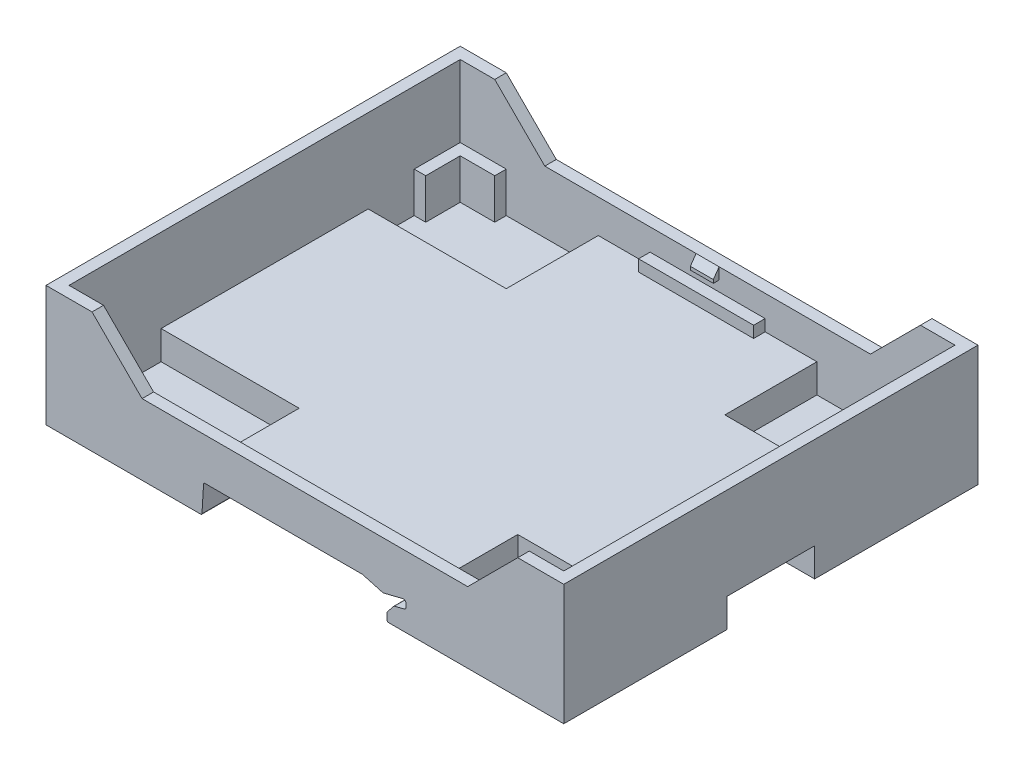
from build123d import *

# Parameters (mm, degrees)
SKETCH_1_W                  = 90
SKETCH_1_H                  = 72
EXTRUDE_1_DEPTH             = 21
CUT_EXTRUDE_1_DEPTH         = 72
FILLET_1_R                  = 0.5
FILLET_2_R                  = 0.2
CUT_EXTRUDE_2_DEPTH         = 28
SKETCH_6_W                  = 5
SKETCH_6_H                  = 2
CUT_EXTRUDE_3_DEPTH         = 2.4
FILLET_3_R                  = 0.5
EXTRUDE_2_DEPTH             = 3.5
FILLET_4_R                  = 1
FILLET_5_R                  = 0.3
CHAMFER_1_SIZE              = 1
SKETCH_8_W                  = 2.9
SKETCH_8_H                  = 4
EXTRUDE_3_DEPTH             = 2.5
CHAMFER_2_SIZE              = 2
CHAMFER_2_SIZE2             = 1.400415076
FILLET_6_R                  = 0.2
FILLET_7_R                  = 0.3
FILLET_8_R                  = 0.2
SKETCH_9_W                  = 15.2
SKETCH_9_H                  = 5
CUT_EXTRUDE_4_DEPTH         = 36
SKETCH_10_W                 = 7.6
SKETCH_10_H                 = 5
CUT_EXTRUDE_5_DEPTH         = 4
CUT_EXTRUDE_6_DEPTH         = 72
SKETCH_12_W                 = 86
SKETCH_12_H                 = 68
CUT_EXTRUDE_7_DEPTH         = 14.5
SKETCH_13_W                 = 24
SKETCH_13_H                 = 16
CUT_EXTRUDE_8_DEPTH         = 5
MIRROR_4_COPY_1_SKETCH_W    = 24
MIRROR_4_COPY_1_SKETCH_H    = 16
MIRROR_4_COPY_1_DEPTH       = 5
EXTRUDE_4_DEPTH             = 7
MIRROR_6_COPY_1_DEPTH       = 7
SKETCH_15_W                 = 20
SKETCH_15_H                 = 2
EXTRUDE_5_DEPTH             = 2
SKETCH_17_W                 = 4
SKETCH_17_H                 = 2
EXTRUDE_6_DEPTH             = 1
CHAMFER_3_SIZE              = 1
CHAMFER_3_SIZE2             = 1.428148007
CHAMFER_3_OF_MIRROR_8_SIZE2 = 1.428148007
CHAMFER_3_OF_MIRROR_8_SIZE  = 1


with BuildPart() as part:
    # 草图1 → 凸台-拉伸1 (new body)
    with BuildSketch(Plane(origin=(0, 0, 0), x_dir=(1, 0, 0), z_dir=(0, 1, 0))):
        Rectangle(SKETCH_1_W, SKETCH_1_H)
    extrude(amount=EXTRUDE_1_DEPTH)

    # 草图4 → 切除-拉伸1 (cut)
    with BuildSketch(Plane.XY.offset(36)):
        Polygon((14.3, 0), (14.3, 1.5), (15.489963906, 2.965295015), (17.6, 3.5), (17.6, 5), (13.598917425, 4.003578801), (10, 5), (-17.6, 5), (-17.9, 0), align=None)
    extrude(amount=-CUT_EXTRUDE_1_DEPTH, mode=Mode.SUBTRACT)

    # 圆角1
    fillet_1_edges = [part.edges().sort_by_distance(p)[0] for p in [
        (17.6, 5, 0),
        (17.6, 3.5, 0),
    ]]
    fillet(fillet_1_edges, radius=FILLET_1_R)

    # 圆角2
    fillet_2_edges = [part.edges().sort_by_distance(p)[0] for p in [
        (14.3, 0, 0),
        (-17.9, 0, 0),
        (-17.6, 5, 0),
        (15.489963906, 2.965295015, 0),
        (14.3, 1.5, 0),
    ]]
    fillet(fillet_2_edges, radius=FILLET_2_R)

    # 草图5 → 切除-拉伸2 (cut)
    with BuildSketch(Plane.ZY.offset(45)):
        Polygon((5.6, 0), (5.6, 2.4), (7.6, 2.4), (7.6, 5), (-7.6, 5), (-7.6, 2.4), (-5.6, 2.4), (-5.6, 0), align=None)
    extrude(amount=-CUT_EXTRUDE_2_DEPTH, mode=Mode.SUBTRACT)

    # 草图6 → 切除-拉伸3 (cut)
    with BuildSketch(Plane.XZ):
        with Locations((-30.5, 6.6)):
            Rectangle(SKETCH_6_W, SKETCH_6_H)
    cut_extrude_3 = extrude(amount=-CUT_EXTRUDE_3_DEPTH, mode=Mode.SUBTRACT)

    # 镜向1: 切除-拉伸3 across plane
    add(cut_extrude_3.mirror(Plane(origin=(0, 0, 0), x_dir=(1, 0, 0), z_dir=(0, 0, -1))), mode=Mode.SUBTRACT)

    # 圆角3
    fillet_3_edges = [part.edges().sort_by_distance(p)[0] for p in [
        (-31.205820162, 5, -7.6),
        (-31.205820162, 5, 7.6),
    ]]
    fillet(fillet_3_edges, radius=FILLET_3_R)

    # 草图7 → 凸台-拉伸2 (add)
    with BuildSketch(Plane.XZ.offset(-5)):
        Polygon((-33, 3.2), (-33, -3.2), (-28, -3.2), (-32, -1), (-32, 1), (-28, 3.2), align=None)
    extrude(amount=EXTRUDE_2_DEPTH)

    # 圆角4
    fillet_4_edges = [part.edges().sort_by_distance(p)[0] for p in [
        (-32, 3.25, -1),
        (-32, 3.25, 1),
    ]]
    fillet(fillet_4_edges, radius=FILLET_4_R)

    # 圆角5
    fillet_5_edges = [part.edges().sort_by_distance(p)[0] for p in [
        (-28, 3.25, 3.2),
        (-28, 3.25, -3.2),
    ]]
    fillet(fillet_5_edges, radius=FILLET_5_R)

    # 倒角1
    chamfer_1_edges = [part.edges().sort_by_distance(p)[0] for p in [
        (-33, 3.25, 3.2),
        (-33, 3.25, -3.2),
    ]]
    chamfer(chamfer_1_edges, length=CHAMFER_1_SIZE)

    # 草图8 → 凸台-拉伸3 (add)
    with BuildSketch(Plane.XZ.offset(-5)):
        with Locations((-35.91, 0)):
            Rectangle(SKETCH_8_W, SKETCH_8_H)
    extrude(amount=EXTRUDE_3_DEPTH)

    # 倒角2
    chamfer_2_edges = [part.edges().sort_by_distance(p)[0] for p in [
        (-34.46, 2.5, 0),
    ]]
    chamfer_2_side = [part.faces().sort_by_distance(p)[0] for p in [
        (-35.91, 2.5, 0),
    ]]
    chamfer(chamfer_2_edges, length=CHAMFER_2_SIZE, length2=CHAMFER_2_SIZE2, reference=chamfer_2_side[0])

    # 圆角6
    fillet_6_edges = [part.edges().sort_by_distance(p)[0] for p in [
        (-37.36, 5, 0),
        (-37.36, 3.75, 2),
        (-35.91, 5, -2),
        (-37.36, 3.75, -2),
        (-34.46, 5, 0),
        (-35.91, 5, 2),
        (-37.36, 2.5, 0),
        (-36.91, 2.5, -2),
        (-34.46, 4.450207538, -2),
        (-35.46, 3.200207538, -2),
    ]]
    fillet(fillet_6_edges, radius=FILLET_6_R)

    # 圆角7
    # the kernel refuses this fillet: 0.3 mm, written as the material it takes off along each edge
    with BuildSketch(Plane(origin=(-36.554589637, 2.8, -2), x_dir=(0.5735764363510475, -0.8191520442889909, 0), z_dir=(0.8191520442889909, 0.5735764363510475, 0))) as fillet_7_piece_1:
        with BuildLine():
            CenterArc((0.1, -0.2), 0.2, 0, 90)
            Line((0.3, -0.2), (0.3, 0))
            Line((0.3, 0), (0.1, 0))
        make_face()
    revolve(axis=Axis((-36.554589637, 2.8, -2), (0, 0, -1)), revolution_arc=35, mode=Mode.SUBTRACT)
    with BuildSketch(Plane(origin=(-36.46, 2.5, 2.236474092), x_dir=(0.8191520442890007, 0.5735764363510335, 0), z_dir=(0, 0, -1))) as fillet_7_piece_2:
        with BuildLine():
            CenterArc((FILLET_7_R * 0.315298788879, -FILLET_7_R), FILLET_7_R, 90, 35)
            Line((-FILLET_7_R * 0.258277647472, -FILLET_7_R * 0.180847955711), (0, 0))
            Line((0, 0), (FILLET_7_R * 0.315298788879, 0))
        make_face()
    extrude(amount=4.236474092, mode=Mode.SUBTRACT)

    # 圆角8
    fillet_8_edges = [part.edges().sort_by_distance(p)[0] for p in [
        (-34.46, 3.900415076, 0.1),
        (-34.522857251, 3.93313649, -1.945574265),
    ]]
    fillet(fillet_8_edges, radius=FILLET_8_R)

    # 草图9 → 切除-拉伸4 (cut)
    with BuildSketch(Plane(origin=(45, 0, 0), x_dir=(0, 0, -1), z_dir=(1, 0, 0))):
        with Locations((0, 2.5)):
            Rectangle(SKETCH_9_W, SKETCH_9_H)
    extrude(amount=-CUT_EXTRUDE_4_DEPTH, mode=Mode.SUBTRACT)

    # 草图10 → 切除-拉伸5 (cut)
    with BuildSketch(Plane(origin=(0, 0, 7.6), x_dir=(-1, 0, 0), z_dir=(0, 0, -1))):
        with Locations((-13.8, 2.5)):
            Rectangle(SKETCH_10_W, SKETCH_10_H)
    cut_extrude_5 = extrude(amount=-CUT_EXTRUDE_5_DEPTH, mode=Mode.SUBTRACT)

    # 镜向2: 切除-拉伸5 across plane
    add(cut_extrude_5.mirror(Plane(origin=(0, 0, 0), x_dir=(1, 0, 0), z_dir=(0, 0, -1))), mode=Mode.SUBTRACT)

    # 草图11 → 切除-拉伸6 (cut)
    with BuildSketch(Plane.XY.offset(36)):
        Polygon((-37, 21), (37, 21), (28.3, 12.3), (-28.3, 12.3), align=None)
    extrude(amount=-CUT_EXTRUDE_6_DEPTH, mode=Mode.SUBTRACT)

    # 草图12 → 切除-拉伸7 (cut)
    with BuildSketch(Plane(origin=(0, 21, 0), x_dir=(1, 0, 0), z_dir=(0, 1, 0))):
        Rectangle(SKETCH_12_W, SKETCH_12_H)
    extrude(amount=-CUT_EXTRUDE_7_DEPTH, mode=Mode.SUBTRACT)

    # 草图13 → 切除-拉伸8 (cut)
    with BuildSketch(Plane(origin=(0, 6.5, 0), x_dir=(1, 0, 0), z_dir=(0, 1, 0))):
        with Locations((31, -26)):
            Rectangle(SKETCH_13_W, SKETCH_13_H)
    cut_extrude_8 = extrude(amount=-CUT_EXTRUDE_8_DEPTH, mode=Mode.SUBTRACT)

    # 镜向3: 切除-拉伸8 across plane
    add(cut_extrude_8.mirror(Plane(origin=(0, 0, 0), x_dir=(1, 0, 0), z_dir=(0, 0, -1))), mode=Mode.SUBTRACT)

    # 镜向4: 切除-拉伸8 across plane
    add(cut_extrude_8.mirror(Plane.ZY), mode=Mode.SUBTRACT)

    # 镜向4 copy 1 sketch → 镜向4 copy 1 (cut)
    with BuildSketch(Plane(origin=(0, 6.5, 0), x_dir=(-1, 0, 0), z_dir=(0, 1, 0))):
        with Locations((31, -26)):
            Rectangle(MIRROR_4_COPY_1_SKETCH_W, MIRROR_4_COPY_1_SKETCH_H)
    extrude(amount=-MIRROR_4_COPY_1_DEPTH, mode=Mode.SUBTRACT)

    # 草图14 → 凸台-拉伸4 (add)
    with BuildSketch(Plane(origin=(0, 1.5, 0), x_dir=(1, 0, 0), z_dir=(0, 1, 0))):
        Polygon((35, -34), (43, -34), (43, -26), (41, -26), (41, -32), (35, -32), align=None)
    extrude_4 = extrude(amount=EXTRUDE_4_DEPTH)

    # 镜向5: 凸台-拉伸4 across plane
    add(extrude_4.mirror(Plane(origin=(0, 0, 0), x_dir=(1, 0, 0), z_dir=(0, 0, -1))))

    # 镜向6: 凸台-拉伸4 across plane
    add(extrude_4.mirror(Plane.ZY))

    # 镜向6 copy 1 sketch → 镜向6 copy 1 (add)
    with BuildSketch(Plane(origin=(0, 1.5, 0), x_dir=(-1, 0, 0), z_dir=(0, 1, 0))):
        Polygon((35, -34), (43, -34), (43, -26), (41, -26), (41, -32), (35, -32), align=None)
    extrude(amount=MIRROR_6_COPY_1_DEPTH)

    # 草图15 → 凸台-拉伸5 (add)
    with BuildSketch(Plane(origin=(0, 6.5, 0), x_dir=(1, 0, 0), z_dir=(0, 1, 0))):
        with Locations((0, 33)):
            Rectangle(SKETCH_15_W, SKETCH_15_H)
    extrude_5 = extrude(amount=EXTRUDE_5_DEPTH)

    # 镜向7: 凸台-拉伸5 across plane
    add(extrude_5.mirror(Plane(origin=(0, 0, 0), x_dir=(1, 0, 0), z_dir=(0, 0, -1))))

    # 草图17 → 凸台-拉伸6 (add)
    with BuildSketch(Plane.XY.offset(-34)):
        with Locations((0, 11.3)):
            Rectangle(SKETCH_17_W, SKETCH_17_H)
    extrude_6 = extrude(amount=EXTRUDE_6_DEPTH)

    # 倒角3
    chamfer_3_edges = [part.edges().sort_by_distance(p)[0] for p in [
        (0, 12.3, -33),
    ]]
    chamfer_3_side = [part.faces().sort_by_distance(p)[0] for p in [
        (0, 12.3, -34.948805461),
    ]]
    chamfer(chamfer_3_edges, length=CHAMFER_3_SIZE, length2=CHAMFER_3_SIZE2, reference=chamfer_3_side[0])

    # 镜向8: 凸台-拉伸6 across plane
    add(extrude_6.mirror(Plane(origin=(0, 0, 0), x_dir=(1, 0, 0), z_dir=(0, 0, -1))))

    # 倒角3 of 镜向8
    chamfer_3_of_mirror_8_edges = [part.edges().sort_by_distance(p)[0] for p in [
        (0, 12.3, 33),
    ]]
    chamfer(chamfer_3_of_mirror_8_edges, length=CHAMFER_3_OF_MIRROR_8_SIZE, length2=CHAMFER_3_OF_MIRROR_8_SIZE2)


solid = part.part
